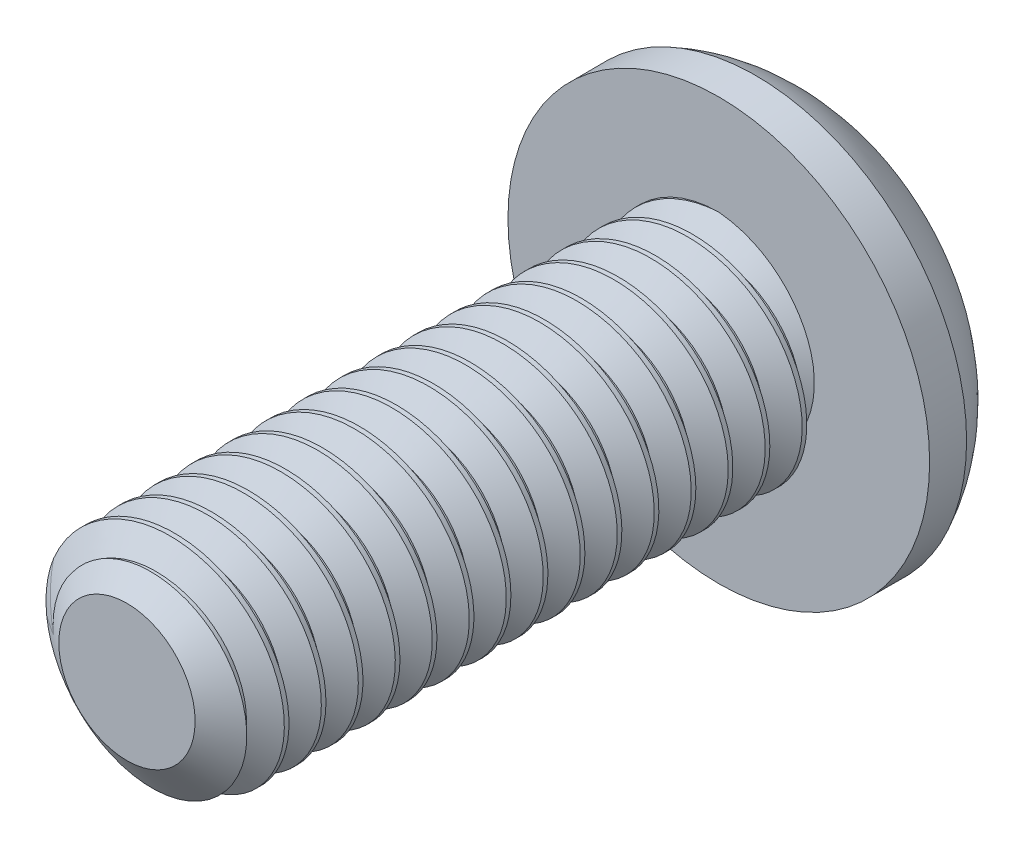
from build123d import *

# Parameters (mm, degrees)
SKETCH1_R          = 1.5
EXTRUDE1_DEPTH     = 8
CUT_SWEEP1_PITCH   = 0.5
SKETCH6_R          = 2.85
EXTRUDE2_DEPTH     = 1.65
CUT_EXTRUDE1_DEPTH = 1.5
SKETCH8_R          = 1.154700538
CUT_EXTRUDE2_DEPTH = 11.457891904
CUT_EXTRUDE2_TAPER = 45


with BuildPart() as part:
    # Sketch1 → Extrude1 (new body)
    with BuildSketch(Plane.XY):
        Circle(SKETCH1_R)
    extrude(amount=-EXTRUDE1_DEPTH)

    # Cut-Sweep1: arcs per turn and ends read off the stored shape
    # Cut-Sweep1: the profile of Sketch3 profile screwed along a right-hand helix through 19 turns, 6 arcs to a turn; built about Z, then put on its axis
    cut_sweep1_z = Axis((0, 0, 0), (0, 0, 1))
    cut_sweep1_corners = [(1.5003, 0, -0.937673205), (1.175240474, 0, -0.75), (1.175240474, 0, -0.6875), (1.5003, 0, -0.499826795)]
    with BuildLine(mode=Mode.PRIVATE) as cut_sweep1_profile:
        Line(cut_sweep1_corners[0], cut_sweep1_corners[1])
        Line(cut_sweep1_corners[1], cut_sweep1_corners[2])
        Line(cut_sweep1_corners[2], cut_sweep1_corners[3])
        Line(cut_sweep1_corners[3], cut_sweep1_corners[0])
    cut_sweep1_cap = Face(cut_sweep1_profile.wire())
    cut_sweep1_turn_angles = [0, 30, 60, 90, 120, 150, 180, 210, 240, 270, 300, 330, 360]
    cut_sweep1_turn_weights = [1, 0.8660254037844387, 1, 0.8660254037844387, 1, 0.8660254037844387, 1, 0.8660254037844387, 1, 0.8660254037844387, 1, 0.8660254037844387, 1]
    cut_sweep1_turn_rails = [Edge.make_bspline([Vector(p[0], p[1], 0).rotate(cut_sweep1_z, cut_sweep1_turn_angles[k]) / cut_sweep1_turn_weights[k] + Vector(0, 0, p[2] + CUT_SWEEP1_PITCH * cut_sweep1_turn_angles[k] / 360) for k in range(13)], [0, 0, 0, 1, 1, 2, 2, 3, 3, 4, 4, 5, 5, 6, 6, 6], 2, cut_sweep1_turn_weights) for p in cut_sweep1_corners]
    cut_sweep1_turn_sides = [Face.make_surface_from_curves(cut_sweep1_turn_rails[p[0]], cut_sweep1_turn_rails[p[1]]) for p in [(0, 1), (1, 2), (2, 3), (3, 0)]]
    cut_sweep1 = Plane(origin=(0, 0, 0), x_dir=(0, 1, 0), z_dir=(0, 0, -1)) * Solid(Shell([*[p.moved(Location((0, 0, CUT_SWEEP1_PITCH * i))) for i in range(19) for p in cut_sweep1_turn_sides], cut_sweep1_cap, cut_sweep1_cap.rotate(cut_sweep1_z, 6840).moved(Location((0, 0, CUT_SWEEP1_PITCH * 6840 / 360)))]))
    add(cut_sweep1, mode=Mode.SUBTRACT)

    # Sketch4 → Cut-Revolve1 (revolve, cut)
    with BuildSketch(Plane(origin=(0, 0, 0), x_dir=(0, 0, -1), z_dir=(1, 0, 0)), mode=Mode.PRIVATE) as cut_revolve1_sk:
        Polygon((0.405251783, 1.5), (0, 0.921240474), (0, 1.5), align=None)
    revolve(cut_revolve1_sk.sketch.rotate(Axis((0, 0, 0), (0, 0, -1)), 263.352109169), axis=Axis((0, 0, 0), (0, 0, -1)), mode=Mode.SUBTRACT)

    # Sketch6 → Extrude2 (add)
    with BuildSketch(Plane(origin=(0, 0, -8), x_dir=(-1, 0, 0), z_dir=(0, 0, -1))):
        with Locations(Location((0, 0, 0), (0, 0, 180))):
            Circle(SKETCH6_R)
    extrude(amount=EXTRUDE2_DEPTH)

    # Sketch10 → Cut-Revolve2 (revolve, cut)
    with BuildSketch(Plane(origin=(0, 0, 0), x_dir=(0, 0, -1), z_dir=(1, 0, 0)), mode=Mode.PRIVATE) as cut_revolve2_sk:
        with BuildLine():
            Line((8.5, 2.85), (8.5, 3.35))
            Line((8.5, 3.35), (10.15, 3.35))
            Line((10.15, 3.35), (10.15, 1))
            Line((10.15, 1), (9.65, 1))
            ThreePointArc((9.65, 1), (9.339069073, 2.089151046), (8.5, 2.85))
        make_face()
    revolve(cut_revolve2_sk.sketch.rotate(Axis((0, 0, 0), (0, 0, -1)), 90), axis=Axis((0, 0, 0), (0, 0, -1)), mode=Mode.SUBTRACT)

    # Sketch7 → Cut-Extrude1 (cut)
    with BuildSketch(Plane(origin=(0, 0, -9.65), x_dir=(-1, 0, 0), z_dir=(0, 0, -1))):
        Polygon((0, 1.154700538), (-1, 0.577350269), (-1, -0.577350269), (0, -1.154700538), (1, -0.577350269), (1, 0.577350269), align=None)
    extrude(amount=-CUT_EXTRUDE1_DEPTH, mode=Mode.SUBTRACT)

    # Sketch8 → Cut-Extrude2 (cut, through all)
    with BuildSketch(Plane.XY.offset(-9.65)):
        Circle(SKETCH8_R)
    extrude(amount=CUT_EXTRUDE2_DEPTH, taper=CUT_EXTRUDE2_TAPER, mode=Mode.SUBTRACT)


solid = part.part
